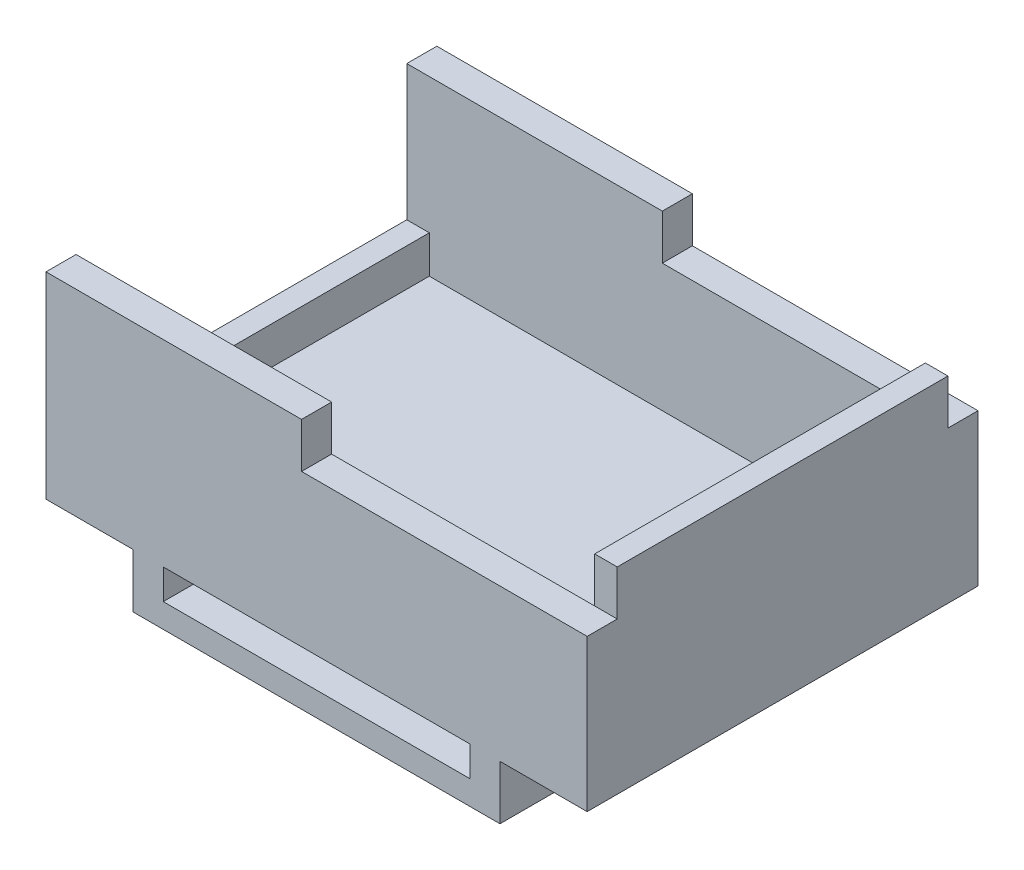
from build123d import *

# Parameters (mm, degrees)
SKETCH_1_W          = 36
SKETCH_1_H          = 26
EXTRUDE_1_DEPTH     = 14.6
SKETCH_2_W          = 33
SKETCH_2_H          = 22
CUT_EXTRUDE_1_DEPTH = 13
SKETCH_3_W          = 36
SKETCH_3_H          = 26
CUT_EXTRUDE_2_DEPTH = 4.5
SKETCH_4_W          = 1.5
SKETCH_4_H          = 22
CUT_EXTRUDE_3_DEPTH = 6
SKETCH_5_W          = 2
SKETCH_5_H          = 4
EXTRUDE_2_DEPTH     = 2
SKETCH_6_W          = 24.4
SKETCH_6_H          = 4
EXTRUDE_3_DEPTH     = 1.6
SKETCH_7_W          = 17
SKETCH_7_H          = 2
SKETCH_7_W_2        = 1.5
SKETCH_7_H_2        = 22
EXTRUDE_4_DEPTH     = 3


with BuildPart() as part:
    # 草图1 → 凸台-拉伸1 (new body)
    with BuildSketch(Plane(origin=(0, 0, 0), x_dir=(1, 0, 0), z_dir=(0, 1, 0))):
        Rectangle(SKETCH_1_W, SKETCH_1_H)
    extrude(amount=EXTRUDE_1_DEPTH)

    # 草图2 → 切除-拉伸1 (cut)
    with BuildSketch(Plane(origin=(0, 14.6, 0), x_dir=(1, 0, 0), z_dir=(0, 1, 0))):
        Rectangle(SKETCH_2_W, SKETCH_2_H)
    extrude(amount=-CUT_EXTRUDE_1_DEPTH, mode=Mode.SUBTRACT)

    # 草图3 → 切除-拉伸2 (cut)
    with BuildSketch(Plane(origin=(0, 14.6, 0), x_dir=(1, 0, 0), z_dir=(0, 1, 0))):
        Rectangle(SKETCH_3_W, SKETCH_3_H)
    extrude(amount=-CUT_EXTRUDE_2_DEPTH, mode=Mode.SUBTRACT)

    # 草图4 → 切除-拉伸3 (cut)
    with BuildSketch(Plane(origin=(0, 10.1, 0), x_dir=(1, 0, 0), z_dir=(0, 1, 0))):
        with Locations((-17.25, 0)):
            Rectangle(SKETCH_4_W, SKETCH_4_H)
    extrude(amount=-CUT_EXTRUDE_3_DEPTH, mode=Mode.SUBTRACT)

    # 草图5 → 凸台-拉伸2 (add)
    with BuildSketch(Plane(origin=(0, 0, 0), x_dir=(-1, 0, 0), z_dir=(0, -1, 0))):
        with Locations((-11.2, -11)):
            Rectangle(SKETCH_5_W, SKETCH_5_H)
        with Locations((11.2, -11)):
            Rectangle(SKETCH_5_W, SKETCH_5_H)
        with Locations((-11.2, 11)):
            Rectangle(SKETCH_5_W, SKETCH_5_H)
        with Locations((11.2, 11)):
            Rectangle(SKETCH_5_W, SKETCH_5_H)
    extrude(amount=EXTRUDE_2_DEPTH)

    # 草图6 → 凸台-拉伸3 (add)
    with BuildSketch(Plane(origin=(0, -2, 0), x_dir=(-1, 0, 0), z_dir=(0, -1, 0))):
        with Locations((0, -11)):
            Rectangle(SKETCH_6_W, SKETCH_6_H)
        with Locations((0, 11)):
            Rectangle(SKETCH_6_W, SKETCH_6_H)
    extrude(amount=EXTRUDE_3_DEPTH)

    # 草图7 → 凸台-拉伸4 (add)
    with BuildSketch(Plane(origin=(0, 10.1, 0), x_dir=(1, 0, 0), z_dir=(0, 1, 0))):
        with Locations((-9.5, 12)):
            Rectangle(SKETCH_7_W, SKETCH_7_H)
        with Locations((-9.5, -12)):
            Rectangle(SKETCH_7_W, SKETCH_7_H)
        with Locations((17.25, 0)):
            Rectangle(SKETCH_7_W_2, SKETCH_7_H_2)
    extrude(amount=EXTRUDE_4_DEPTH)


solid = part.part
